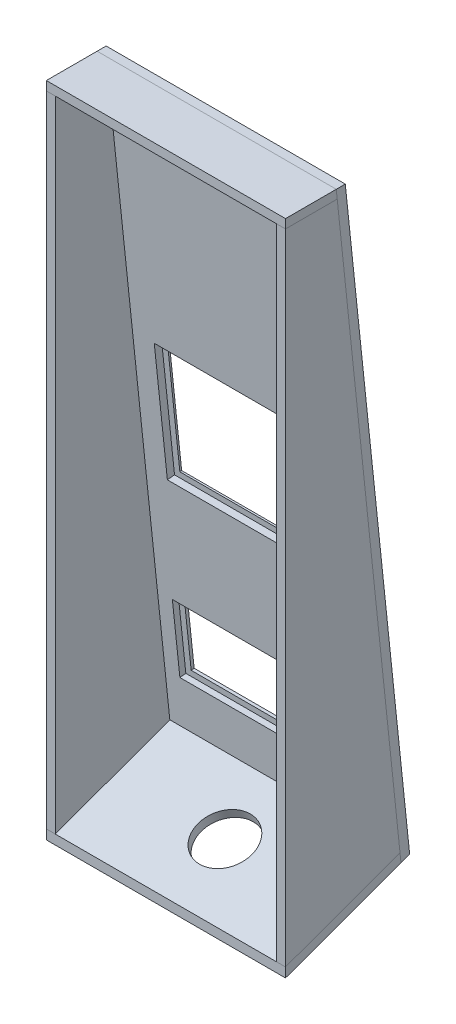
from build123d import *

# Parameters (mm, degrees)
SKETCH6_W          = 300
SKETCH6_H          = 100
SKETCH6_W_2        = 277
SKETCH6_H_2        = 190
CUT_EXTRUDE1_DEPTH = 50
SHELL1_T           = -15
SKETCH7_R          = 45
CUT_EXTRUDE2_DEPTH = 50
SPLIT3_START       = -400
SPLIT3_DEPTH       = 154.9999999
SPLIT3_START_2     = -154.9999999
SPLIT3_2_DEPTH     = 154.9999999
SPLIT3_START_3     = -245.0000001
SPLIT3_3_DEPTH     = 90.0000002
SPLIT3_START_4     = -8306.126404087
SPLIT3_4_OUTLINE_R = 45
SPLIT3_4_DEPTH     = 15
SPLIT3_5_DEPTH     = 385
SPLIT3_6_DEPTH     = 155.9999999
SPLIT3_7_DEPTH     = 15
SPLIT3_8_DEPTH     = 400
SKETCH9_W          = 297
SKETCH9_H          = 210
CUT_EXTRUDE3_DEPTH = 12
SKETCH10_W         = 320
SKETCH10_H         = 120
CUT_EXTRUDE4_DEPTH = 10


with BuildPart() as part:
    # Sketch4 → Loft1 section 0
    with BuildSketch(Plane(origin=(0, -74.173200619, 705.710863428), x_dir=(1, 0, 0), z_dir=(0, 0.10452846326765355, -0.9945218953682733))):
        with BuildLine():
            Line((0, 7708.052316477), (-400, 7708.052316477))
            Line((-400, 7708.052316477), (-400, 8738.052316477))
            Line((-400, 8738.052316477), (0, 8738.052316477))
            Line((0, 8738.052316477), (0, 7708.052316477))
        make_face()
    # Sketch2 → Loft1 section 1
    with BuildSketch(Plane.XY):
        with BuildLine():
            Line((0, -7740), (-400, -7740))
            Line((-400, -7740), (-400, -8840))
            Line((-400, -8840), (0, -8840))
            Line((0, -8840), (0, -7740))
        make_face()
    loft()

    # Sketch6 → Cut-Extrude1 (cut)
    with BuildSketch(Plane(origin=(0, -74.173200619, 705.710863428), x_dir=(-1, 0, 0), z_dir=(0, 0.1045284632676537, -0.9945218953682733))):
        with Locations((200, -8588.052316477)):
            Rectangle(SKETCH6_W, SKETCH6_H)
        with Locations((200, -8233.052316477)):
            Rectangle(SKETCH6_W_2, SKETCH6_H_2)
    extrude(amount=-CUT_EXTRUDE1_DEPTH, mode=Mode.SUBTRACT)

    # Shell1
    shell1_openings = [part.faces().sort_by_distance(p)[0] for p in [
        (-200, -8290, 0),
        (-200, -8667.518574274, -172.348423455),
        (-350, -8617.792479506, -167.122000291),
        (-200, -8568.066384737, -161.895577128),
        (-50, -8617.792479506, -167.122000291),
        (-61.5, -8264.73720665, -130.014395831),
        (-200, -8359.21678671, -139.944599842),
        (-338.5, -8264.73720665, -130.014395831),
        (-200, -8170.25762659, -120.084191821),
        (-200, -8620.405691087, -142.258952907),
        (-200, -8267.350418232, -105.151348447),
    ]]
    offset(amount=SHELL1_T, openings=shell1_openings, kind=Kind.INTERSECTION)

    # Sketch7 → Cut-Extrude2 (cut)
    with BuildSketch(Plane(origin=(0, -7804.495004601, -2842.814373791), x_dir=(1, 0, 0), z_dir=(0, -0.9396070592858664, -0.3422551301882362))):
        with Locations(Location((-200, 2915.029413774, 0), (0, 0, 270))):
            Circle(SKETCH7_R)
    extrude(amount=-CUT_EXTRUDE2_DEPTH, mode=Mode.SUBTRACT)


with BuildPart() as body_2:
    # Split2: the piece on the far side of the plane
    add(part.part)
    split(bisect_by=Plane(origin=(0, -75.741127568, 720.628691859), x_dir=(0, 0.9945218953682734, 0.1045284632676536), z_dir=(0, -0.1045284632676536, 0.9945218953682734)), keep=Keep.BOTTOM)

    # Sketch9 → Cut-Extrude3 (cut)
    with BuildSketch(Plane(origin=(0, -75.741127568, 720.628691859), x_dir=(1, 0, 0), z_dir=(0, -0.1045284632676536, 0.9945218953682734))):
        with Locations((-200, -8233.052316477)):
            Rectangle(SKETCH9_W, SKETCH9_H)
    extrude(amount=-CUT_EXTRUDE3_DEPTH, mode=Mode.SUBTRACT)

    # Sketch10 → Cut-Extrude4 (cut)
    with BuildSketch(Plane(origin=(0, -75.741127568, 720.628691859), x_dir=(1, 0, 0), z_dir=(0, -0.1045284632676536, 0.9945218953682734))):
        with Locations((-200, -8588.052316477)):
            Rectangle(SKETCH10_W, SKETCH10_H)
    extrude(amount=-CUT_EXTRUDE4_DEPTH, mode=Mode.SUBTRACT)


with BuildPart() as part_1:
    add(part.part)

    # Split2
    split(bisect_by=Plane(origin=(0, -75.741127568, 720.628691859), x_dir=(0, 0.9945218953682734, 0.1045284632676536), z_dir=(0, -0.1045284632676536, 0.9945218953682734)), keep=Keep.TOP)

    # Split3 5 outline → Split3 5 (cut)
    with BuildSketch(Plane.YZ.offset(SPLIT3_START)):
        Polygon((-8769.648874346, -193.137833337), (-7740, -84.917375807), (-7740, 0), (-8840, 0), align=None)
    extrude(amount=SPLIT3_5_DEPTH, mode=Mode.SUBTRACT)

    # Split3 6 outline → Split3 6 (cut)
    with BuildSketch(Plane.YZ.offset(SPLIT3_START_2)):
        Polygon((-8769.648874346, -193.137833337), (-8754.273397877, -191.521805641), (-8824.035879838, 0), (-8840, 0), align=None)
        Polygon((-7755, 0), (-7755, -86.493939336), (-7740, -84.917375807), (-7740, 0), align=None)
    extrude(amount=SPLIT3_6_DEPTH, mode=Mode.SUBTRACT)


with BuildPart() as body_3:
    # Split3: read off the stored shape, not the designer's step
    # Split3 outline → Split3 (new body)
    with BuildSketch(Plane.YZ.offset(SPLIT3_START)):
        Polygon((-8769.648874346, -193.137833337), (-8754.273397877, -191.521805641), (-8824.035879838, 0), (-8840, 0), align=None)
    extrude(amount=SPLIT3_DEPTH)

    # Split3 2 outline → Split3 2 (add)
    with BuildSketch(Plane.YZ.offset(SPLIT3_START_2)):
        Polygon((-8769.648874346, -193.137833337), (-8754.273397877, -191.521805641), (-8824.035879838, 0), (-8840, 0), align=None)
    extrude(amount=SPLIT3_2_DEPTH)

    # Split3 3 outline → Split3 3 (add)
    with BuildSketch(Plane.YZ.offset(SPLIT3_START_3)):
        Polygon((-8769.648874346, -193.137833337), (-8754.273397877, -191.521805641), (-8824.035879838, 0), (-8840, 0), align=None)
    extrude(amount=SPLIT3_3_DEPTH)

    # Split3 4 outline → Split3 4 (cut)
    with BuildSketch(Plane(origin=(0, 0, 0), x_dir=(1, 0, 0), z_dir=(0, 0.9396070592858664, 0.34225513018823617)).offset(SPLIT3_START_4)):
        with Locations((-200, -2915.029413774)):
            Circle(SPLIT3_4_OUTLINE_R)
    extrude(amount=SPLIT3_4_DEPTH, mode=Mode.SUBTRACT)


with BuildPart() as body_4:
    # Split3 7 outline → Split3 7 (new body)
    with BuildSketch(Plane.YZ.offset(SPLIT3_START)):
        Polygon((-8824.035879838, 0), (-8754.273397877, -191.521805641), (-7755, -86.493939336), (-7755, 0), align=None)
    extrude(amount=SPLIT3_7_DEPTH)


with BuildPart() as body_5:
    # Split3 8 outline → Split3 8 (new body)
    with BuildSketch(Plane.YZ.offset(SPLIT3_START)):
        Polygon((-7740, 0), (-7755, 0), (-7755, -86.493939336), (-7740, -84.917375807), align=None)
    extrude(amount=SPLIT3_8_DEPTH)


solid = Compound([body_2.part, part_1.part, body_3.part, body_4.part, body_5.part])
